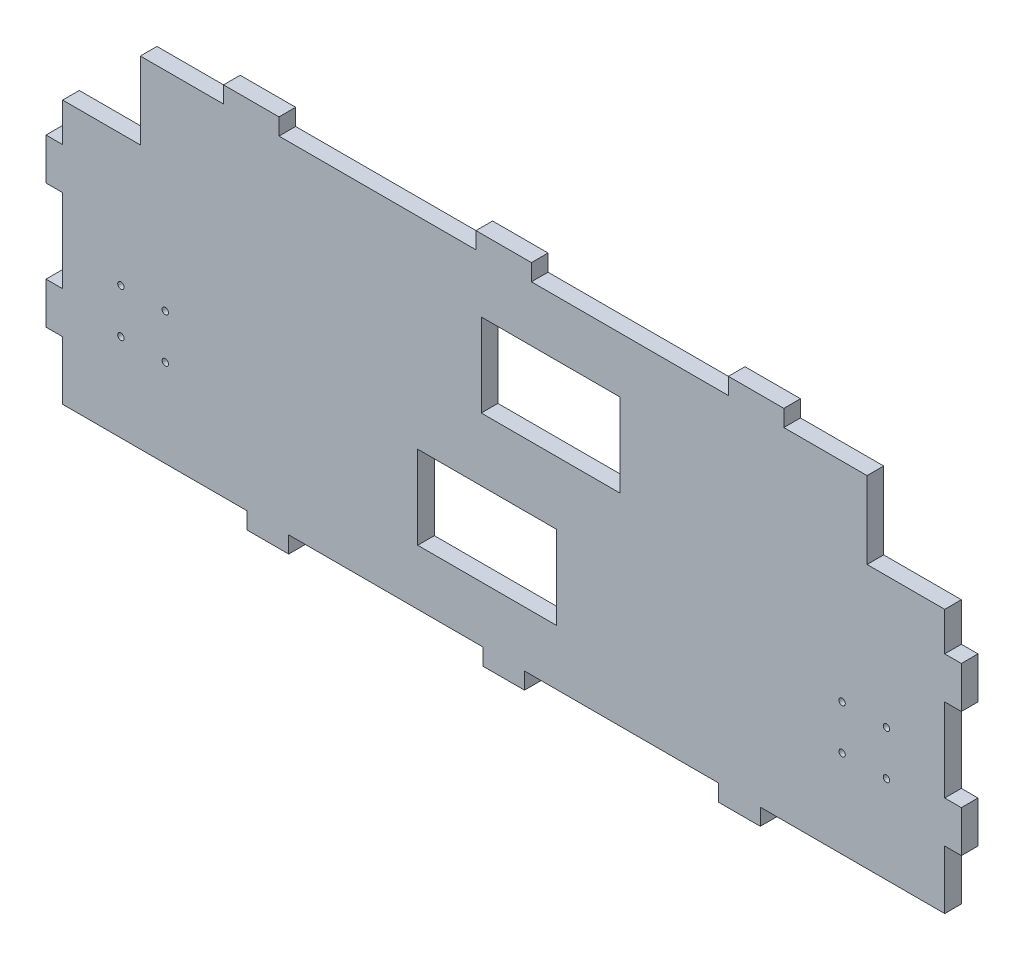
from build123d import *

# Parameters (mm, degrees)
ESQUISSE1_W             = 50
ESQUISSE1_H             = 30
BOSS_EXTRU_1_DEPTH      = 6
ESQUISSE2_W             = 15
ESQUISSE2_H             = 6
ESQUISSE2_W_2           = 6
ESQUISSE2_H_2           = 15
ESQUISSE2_W_3           = 20
BOSS_EXTRU_2_DEPTH      = 6
ESQUISSE3_R             = 1.15
ENL_V_MAT_EXTRU_1_DEPTH = 6


with BuildPart() as part:
    # Esquisse1 → Boss.-Extru.1 (new body)
    with BuildSketch(Plane.XY):
        Polygon((-159, 35), (-131, 35), (-131, 62.75), (131, 62.75), (131, 35), (159, 35), (159, -60), (-159, -60), align=None)
        with Locations((-6, -25)):
            Rectangle(ESQUISSE1_W, ESQUISSE1_H, mode=Mode.SUBTRACT)
        with Locations((16.916466651, 27.75)):
            Rectangle(ESQUISSE1_W, ESQUISSE1_H, mode=Mode.SUBTRACT)
    extrude(amount=BOSS_EXTRU_1_DEPTH)

    # Esquisse2 → Boss.-Extru.2 (add)
    with BuildSketch(Plane.XY.offset(6)):
        with Locations((-85, -63)):
            Rectangle(ESQUISSE2_W, ESQUISSE2_H)
        with Locations((0, -63)):
            Rectangle(ESQUISSE2_W, ESQUISSE2_H)
        with Locations((85, -63)):
            Rectangle(ESQUISSE2_W, ESQUISSE2_H)
        with Locations((-162, 13.59)):
            Rectangle(ESQUISSE2_W_2, ESQUISSE2_H_2)
        with Locations((-162, -31.41)):
            Rectangle(ESQUISSE2_W_2, ESQUISSE2_H_2)
        with Locations((162, -31.41)):
            Rectangle(ESQUISSE2_W_2, ESQUISSE2_H_2)
        with Locations((162, 13.59)):
            Rectangle(ESQUISSE2_W_2, ESQUISSE2_H_2)
        with Locations((91, 65.75)):
            Rectangle(ESQUISSE2_W_3, ESQUISSE2_H)
        with Locations((-91, 65.75)):
            Rectangle(ESQUISSE2_W_3, ESQUISSE2_H)
        with Locations((0, 65.75)):
            Rectangle(ESQUISSE2_W_3, ESQUISSE2_H)
    extrude(amount=-BOSS_EXTRU_2_DEPTH)

    # Esquisse3 → Enlèv. mat.-Extru.1 (cut)
    with BuildSketch(Plane(origin=(0, 0, 0), x_dir=(-1, 0, 0), z_dir=(0, 0, -1))):
        with Locations((138, -28.38)):
            Circle(ESQUISSE3_R)
        with Locations((138, -12.38)):
            Circle(ESQUISSE3_R)
        with Locations((122, -12.38)):
            Circle(ESQUISSE3_R)
        with Locations((122, -28.38)):
            Circle(ESQUISSE3_R)
        with Locations((-122, -28.38)):
            Circle(ESQUISSE3_R)
        with Locations((-122, -12.38)):
            Circle(ESQUISSE3_R)
        with Locations((-138, -12.38)):
            Circle(ESQUISSE3_R)
        with Locations((-138, -28.38)):
            Circle(ESQUISSE3_R)
    extrude(amount=-ENL_V_MAT_EXTRU_1_DEPTH, mode=Mode.SUBTRACT)


solid = part.part
